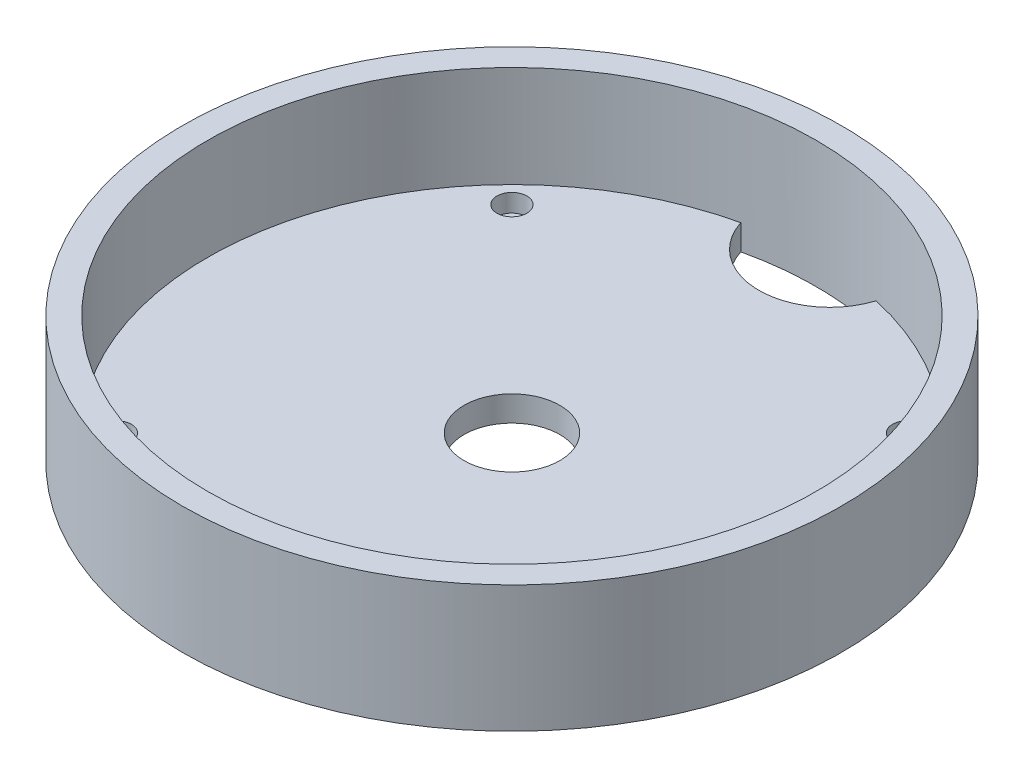
from build123d import *

# Parameters (mm, degrees)
SKETCH1_R           = 82.55
SKETCH1_R_2         = 12
BOSS_EXTRUDE1_DEPTH = 6.35
BOSS_EXTRUDE2_START = 25.4
SKETCH1_3_R         = 82.55
BOSS_EXTRUDE2_DEPTH = 25.4
SKETCH5_R           = 3.75
SKETCH5_R_2         = 2.25
CUT_EXTRUDE1_DEPTH  = 4.49999989
SKETCH5_4_R         = 2.25
CUT_EXTRUDE2_DEPTH  = 12.7


with BuildPart() as part:
    # Sketch1 → Boss-Extrude1 (new body)
    with BuildSketch(Plane(origin=(0, 0, 0), x_dir=(1, 0, 0), z_dir=(0, 1, 0))):
        Circle(SKETCH1_R)
        with BuildLine():
            ThreePointArc((16.956095167, 74.289506908), (0, 61.859201916), (-16.956095167, 74.289506908))
            ThreePointArc((-16.956095167, 74.289506908), (0, 76.2), (16.956095167, 74.289506908))
        make_face(mode=Mode.SUBTRACT)
        Circle(SKETCH1_R_2, mode=Mode.SUBTRACT)
    extrude(amount=-BOSS_EXTRUDE1_DEPTH)

    # Sketch1<3> → Boss-Extrude2 (add)
    with BuildSketch(Plane(origin=(0, 0, 0), x_dir=(1, 0, 0), z_dir=(0, 1, 0)).offset(BOSS_EXTRUDE2_START)):
        Circle(SKETCH1_3_R)
        with BuildLine():
            ThreePointArc((16.956095167, 74.289506908), (59.575558964, 47.509922902), (76.2, 0))
            ThreePointArc((76.2, 0), (-47.509922902, -59.575558964), (-16.956095167, 74.289506908))
            ThreePointArc((-16.956095167, 74.289506908), (0, 76.2), (16.956095167, 74.289506908))
        make_face(mode=Mode.SUBTRACT)
    extrude(amount=-BOSS_EXTRUDE2_DEPTH)

    # Sketch5 → Cut-Extrude1 (cut)
    # profile 1 of 4: a face of its own
    with BuildSketch(Plane(origin=(0, 0, 0), x_dir=(1, 0, 0), z_dir=(0, 1, 0))):
        with Locations((-49.53, -49.53)):
            Circle(SKETCH5_R)
        with Locations((-49.53, -49.53)):
            Circle(SKETCH5_R_2, mode=Mode.SUBTRACT)
    # profile 2 of 4: a face of its own
    with BuildSketch(Plane(origin=(0, 0, 0), x_dir=(1, 0, 0), z_dir=(0, 1, 0))):
        with Locations((-49.53, 49.53)):
            Circle(SKETCH5_R)
        with Locations((-49.53, 49.53)):
            Circle(SKETCH5_R_2, mode=Mode.SUBTRACT)
    # profile 3 of 4: a face of its own
    with BuildSketch(Plane(origin=(0, 0, 0), x_dir=(1, 0, 0), z_dir=(0, 1, 0))):
        with Locations((49.53, 49.53)):
            Circle(SKETCH5_R)
        with Locations((49.53, 49.53)):
            Circle(SKETCH5_R_2, mode=Mode.SUBTRACT)
    # profile 4 of 4: a face of its own
    with BuildSketch(Plane(origin=(0, 0, 0), x_dir=(1, 0, 0), z_dir=(0, 1, 0))):
        with Locations((49.53, -49.53)):
            Circle(SKETCH5_R)
        with Locations((49.53, -49.53)):
            Circle(SKETCH5_R_2, mode=Mode.SUBTRACT)
    extrude(amount=-CUT_EXTRUDE1_DEPTH, mode=Mode.SUBTRACT)

    # Sketch5<4> → Cut-Extrude2 (cut)
    with BuildSketch(Plane(origin=(0, 0, 0), x_dir=(1, 0, 0), z_dir=(0, 1, 0))):
        with Locations((-49.53, 49.53)):
            Circle(SKETCH5_4_R)
        with Locations((49.53, 49.53)):
            Circle(SKETCH5_4_R)
        with Locations((49.53, -49.53)):
            Circle(SKETCH5_4_R)
        with Locations((-49.53, -49.53)):
            Circle(SKETCH5_4_R)
    extrude(amount=-CUT_EXTRUDE2_DEPTH, mode=Mode.SUBTRACT)


solid = part.part
